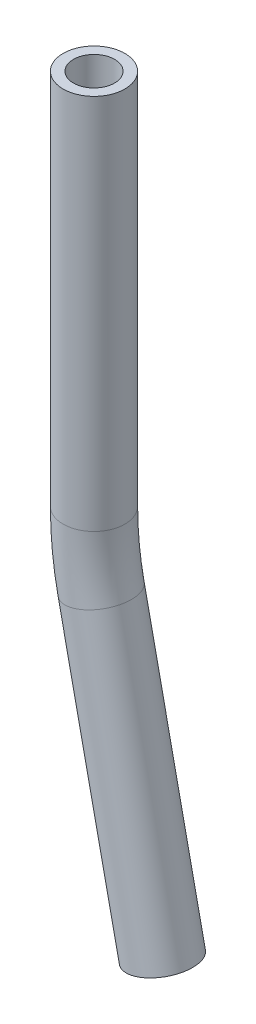
from build123d import *

# Parameters (mm, degrees)
SKETCH1_R   = 4.7625
SKETCH1_R_2 = 3.175


with BuildPart() as part:
    # Sweep1: sweep along a path in Sketch2
    with BuildLine(Plane.XY) as sweep1_path:
        Line((0, 0), (0, -58.160704849))
        ThreePointArc((0, -58.160704849), (0.278287715, -63.470750783), (1.110101883, -68.722618742))
        Line((1.110101883, -68.722618742), (10.561913894, -113.189898117))
    # Sketch1 → Sweep1 (sweep)
    with BuildSketch(Plane(origin=(0, 0, 0), x_dir=(1, 0, 0), z_dir=(0, 1, 0))):
        Circle(SKETCH1_R)
        Circle(SKETCH1_R_2, mode=Mode.SUBTRACT)
    sweep(path=sweep1_path.line)


solid = part.part
